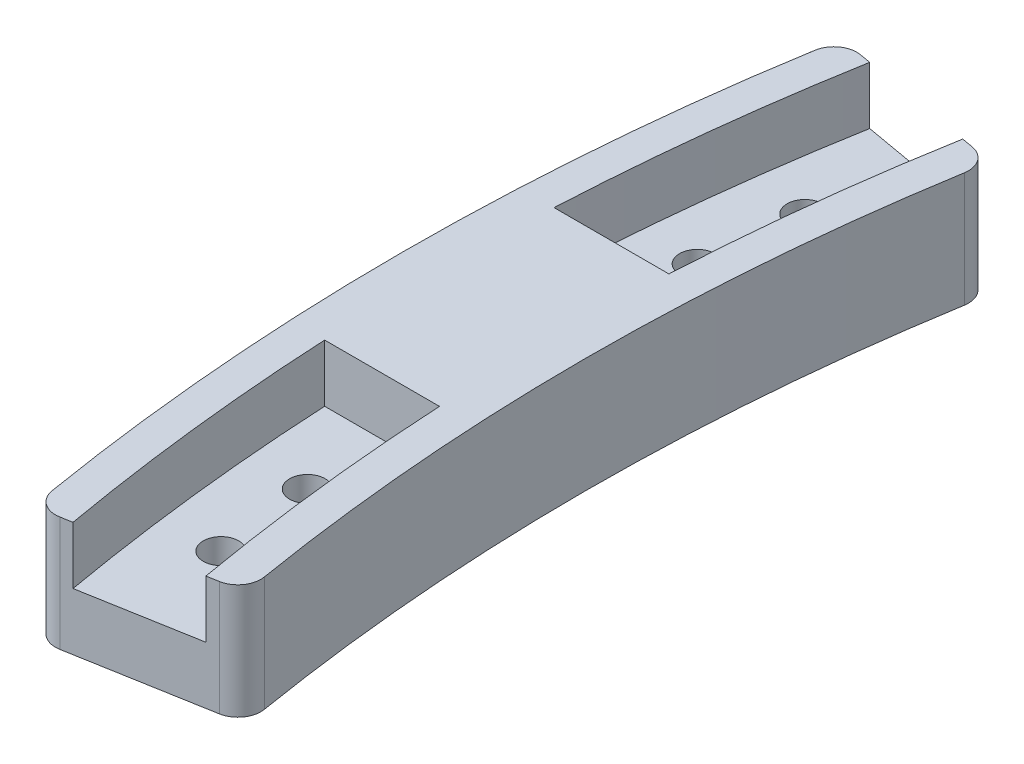
from build123d import *

# Parameters (mm, degrees)
BOSS_EXTRUDE1_DEPTH        = 10
CUT_EXTRUDE1_DEPTH         = 5
F_3_1_3_1_DIAMETER_HOLE2_D = 3.1
FILLET1_R                  = 2


with BuildPart() as part:
    # Sketch1 → Boss-Extrude1 (new body)
    with BuildSketch(Plane(origin=(0, 0, 0), x_dir=(1, 0, 0), z_dir=(0, 1, 0))):
        with BuildLine():
            Line((-199.915973861, -35.250580066), (-184.159049813, -32.472209224))
            ThreePointArc((-184.159049813, -32.472209224), (-187, 0), (-184.159049813, 32.472209224))
            Line((-184.159049813, 32.472209224), (-199.915973861, 35.250580066))
            ThreePointArc((-199.915973861, 35.250580066), (-203, 0), (-199.915973861, -35.250580066))
        make_face()
    extrude(amount=BOSS_EXTRUDE1_DEPTH)

    # Sketch15 → Cut-Extrude1 (cut)
    with BuildSketch(Plane(origin=(0, 10, 0), x_dir=(1, 0, 0), z_dir=(0, 1, 0))):
        with BuildLine():
            Line((-199.749843554, 10), (-189.73665961, 10))
            ThreePointArc((-189.73665961, 10), (-188.775466906, 21.536552519), (-187.113473072, 32.993153757))
            Line((-187.113473072, 32.993153757), (-196.961550602, 34.729635533))
            ThreePointArc((-196.961550602, 34.729635533), (-198.7407137, 22.408228804), (-199.749843554, 10))
        make_face()
        with BuildLine():
            ThreePointArc((-187.113473072, -32.993153757), (-188.775466906, -21.536552519), (-189.73665961, -10))
            Line((-189.73665961, -10), (-199.749843554, -10))
            ThreePointArc((-199.749843554, -10), (-198.7407137, -22.408228804), (-196.961550602, -34.729635533))
            Line((-196.961550602, -34.729635533), (-187.113473072, -32.993153757))
        make_face()
    extrude(amount=-CUT_EXTRUDE1_DEPTH, mode=Mode.SUBTRACT)

    # Ø3.1 (3.1) Diameter Hole2 (through all)
    with Locations(Plane(origin=(0, 0, 0), x_dir=(-1, 0, 0), z_dir=(0, -1, 0))):
        with Locations((193.331747968, -25.452607483), (194.257966128, -16.995369836), (194.257966128, 16.995369836), (193.331747968, 25.452607483)):
            Hole(F_3_1_3_1_DIAMETER_HOLE2_D / 2)

    # Fillet1
    fillet1_edges = [part.edges().sort_by_distance(p)[0] for p in [
        (-199.915973861, 5, -35.250580066),
        (-184.159049813, 5, -32.472209224),
        (-199.915973861, 5, 35.250580066),
        (-184.159049813, 5, 32.472209224),
    ]]
    fillet(fillet1_edges, radius=FILLET1_R)


solid = part.part
